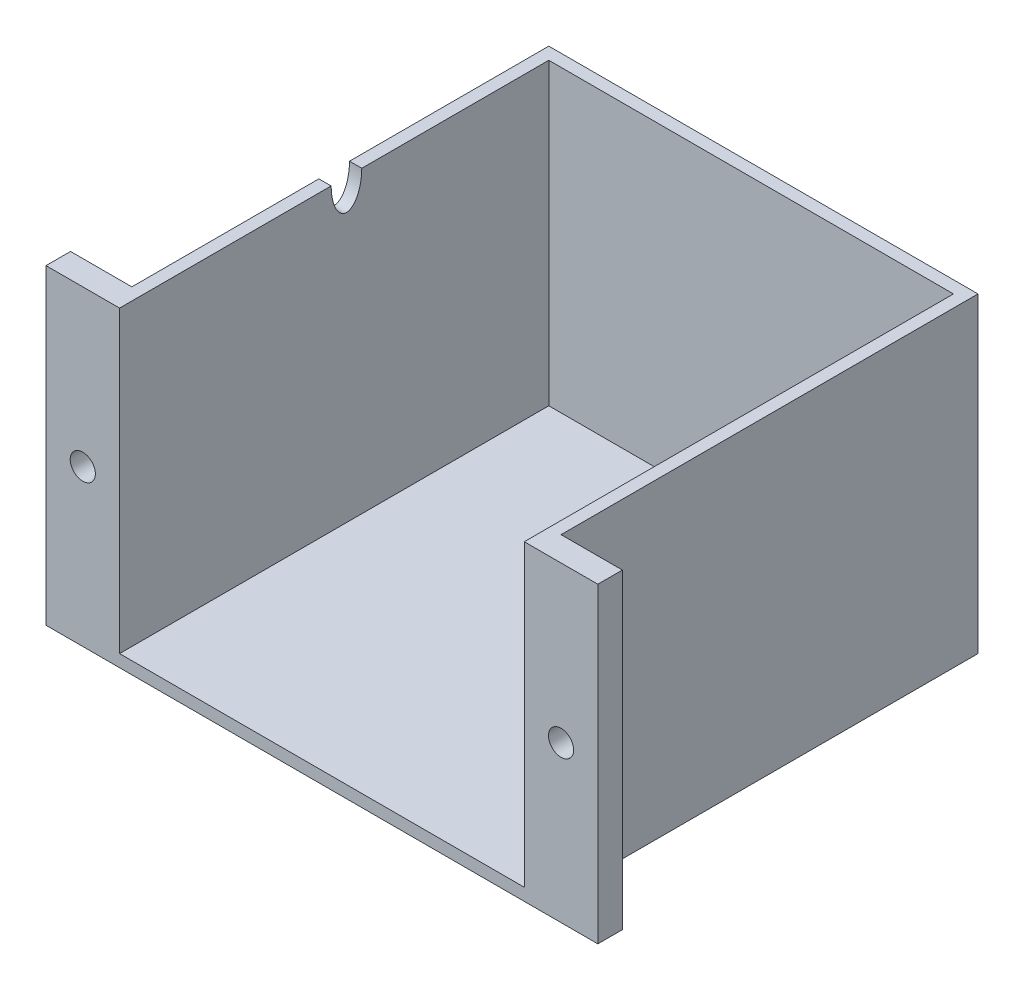
from build123d import *

# Parameters (mm, degrees)
BOSS_EXTRUDE1_DEPTH             = 50.8
CABLEHOLECUT_EXTRUDE1_DEPTH     = 116.276363579
BOTTOMCOVERSKETCH3_W            = 66
BOTTOMCOVERSKETCH3_H            = 2
BOTTOMCOVERBOSS_EXTRUDE2_DEPTH  = 70
MOUNTINGHOLESSKETCH4_R          = 2.05
MOUNTINGHOLESCUT_EXTRUDE2_DEPTH = 4


with BuildPart() as part:
    # Sketch1 → Boss-Extrude1 (new body)
    with BuildSketch(Plane(origin=(0, 0, 0), x_dir=(1, 0, 0), z_dir=(0, 1, 0))):
        Polygon((-10, 0), (0, 0), (0, 68), (70, 68), (70, 0), (80, 0), (80, -4), (68, -4), (68, 66), (2, 66), (2, -4), (-10, -4), align=None)
    extrude(amount=BOSS_EXTRUDE1_DEPTH)

    # CableHoleSketch2 → CableHoleCut-Extrude1 (cut, through all)
    with BuildSketch(Plane(origin=(2, 0, 0), x_dir=(0, 0, -1), z_dir=(1, 0, 0))):
        with BuildLine():
            Line((30.5, 50.8), (35.5, 50.8))
            add(Edge.make_bspline(
                [(30.5, 50.8), (30.5, 45.8), (33, 45.8), (35.5, 45.8), (35.5, 50.8)],
                knots=[4.71238898, 4.71238898, 4.71238898, 6.283185307, 6.283185307, 7.853981634, 7.853981634, 7.853981634], degree=2, weights=[1, 0.707106781, 1, 0.707106781, 1]))
        make_face()
    extrude(amount=-CABLEHOLECUT_EXTRUDE1_DEPTH, mode=Mode.SUBTRACT)

    # BottomCoverSketch3 → BottomCoverBoss-Extrude2 (add)
    with BuildSketch(Plane.XY.offset(-66)):
        with Locations((35, 1)):
            Rectangle(BOTTOMCOVERSKETCH3_W, BOTTOMCOVERSKETCH3_H)
    extrude(amount=BOTTOMCOVERBOSS_EXTRUDE2_DEPTH)

    # MountingHolesSketch4 → MountingHolesCut-Extrude2 (cut)
    with BuildSketch(Plane.XY.offset(4)):
        with Locations((74, 25.4)):
            Circle(MOUNTINGHOLESSKETCH4_R)
        with Locations((-4, 25.4)):
            Circle(MOUNTINGHOLESSKETCH4_R)
    extrude(amount=-MOUNTINGHOLESCUT_EXTRUDE2_DEPTH, mode=Mode.SUBTRACT)


solid = part.part
